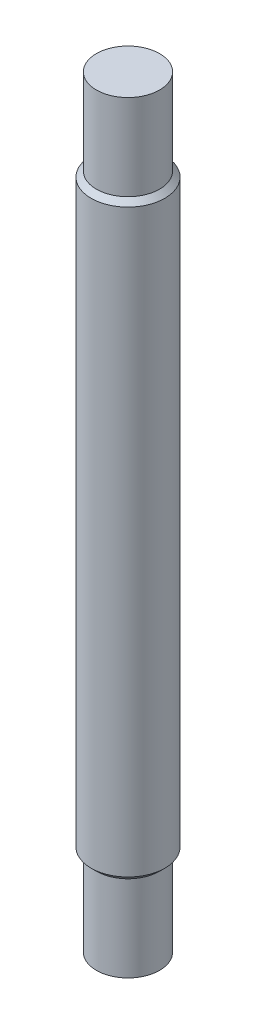
from build123d import *

# Parameters (mm, degrees)
BOSS_EXTRUDE1_DEPTH      = 230
BOSS_EXTRUDE1_DEPTH_BACK = 230
SKETCH1_R                = 22.225
SKETCH2_R                = 25.4
SKETCH2_R_2              = 19.05
CUT_EXTRUDE1_DEPTH       = 50
CHAMFER1_SIZE            = 5
CUT_EXTRUDE2_START       = -50
SKETCH3_R                = 25.4
SKETCH3_R_2              = 19.05
CUT_EXTRUDE2_DEPTH       = 50
CHAMFER2_SIZE            = 5


with BuildPart() as part:
    # Sketch1 → Boss-Extrude1 (new, two sides: drawn at the far end of the back side and taken through both)
    with BuildSketch(Plane(origin=(0, 0, 0), x_dir=(1, 0, 0), z_dir=(0, 1, 0)).offset(-BOSS_EXTRUDE1_DEPTH_BACK)):
        with Locations(Location((0, 0, 0), (0, 0, 270))):
            Circle(SKETCH1_R)
    extrude(amount=BOSS_EXTRUDE1_DEPTH + BOSS_EXTRUDE1_DEPTH_BACK)

    # Sketch2 → Cut-Extrude1 (cut)
    with BuildSketch(Plane(origin=(0, 230, 0), x_dir=(1, 0, 0), z_dir=(0, 1, 0))):
        Circle(SKETCH2_R)
        with Locations(Location((0, 0, 0), (0, 0, 270))):
            Circle(SKETCH2_R_2, mode=Mode.SUBTRACT)
    extrude(amount=-CUT_EXTRUDE1_DEPTH, mode=Mode.SUBTRACT)

    # Chamfer1
    # the kernel refuses this chamfer: 5 mm, written as the material it takes off along each edge
    with BuildSketch(Plane(origin=(0, 180, 0), x_dir=(0, 0, 1), z_dir=(1, 0, 0))) as chamfer1_piece_1_section:
        Polygon((22.225, CHAMFER1_SIZE), (22.225 - CHAMFER1_SIZE, 0), (22.225, 0), align=None)
    chamfer1_piece_1 = revolve(axis=Axis((0, 180, 0), (0, -1, 0)), mode=Mode.PRIVATE)
    chamfer1_piece_1 = chamfer1_piece_1 - Plane(origin=(0, 176.598584916, 0), x_dir=(0, 0, 1), z_dir=(0, 1, 0)) * Cylinder(19.05, 89, mode=Mode.PRIVATE)
    add(chamfer1_piece_1, mode=Mode.SUBTRACT)

    # Sketch3 → Cut-Extrude2 (cut)
    with BuildSketch(Plane(origin=(0, -230, 0), x_dir=(-1, 0, 0), z_dir=(0, -1, 0)).offset(CUT_EXTRUDE2_START)):
        Circle(SKETCH3_R)
        with Locations(Location((0, 0, 0), (0, 0, 270))):
            Circle(SKETCH3_R_2, mode=Mode.SUBTRACT)
    extrude(amount=CUT_EXTRUDE2_DEPTH, mode=Mode.SUBTRACT)

    # Chamfer2
    # the kernel refuses this chamfer: 5 mm, written as the material it takes off along each edge
    with BuildSketch(Plane(origin=(0, -180, 0), x_dir=(0, 0, 1), z_dir=(-1, 0, 0))) as chamfer2_piece_1_section:
        Polygon((22.225, CHAMFER2_SIZE), (22.225 - CHAMFER2_SIZE, 0), (22.225, 0), align=None)
    chamfer2_piece_1 = revolve(axis=Axis((0, -180, 0), (0, 1, 0)), mode=Mode.PRIVATE)
    chamfer2_piece_1 = chamfer2_piece_1 - Plane(origin=(0, -176.598584916, 0), x_dir=(0, 0, 1), z_dir=(0, 1, 0)) * Cylinder(19.05, 89, mode=Mode.PRIVATE)
    add(chamfer2_piece_1, mode=Mode.SUBTRACT)


solid = part.part
